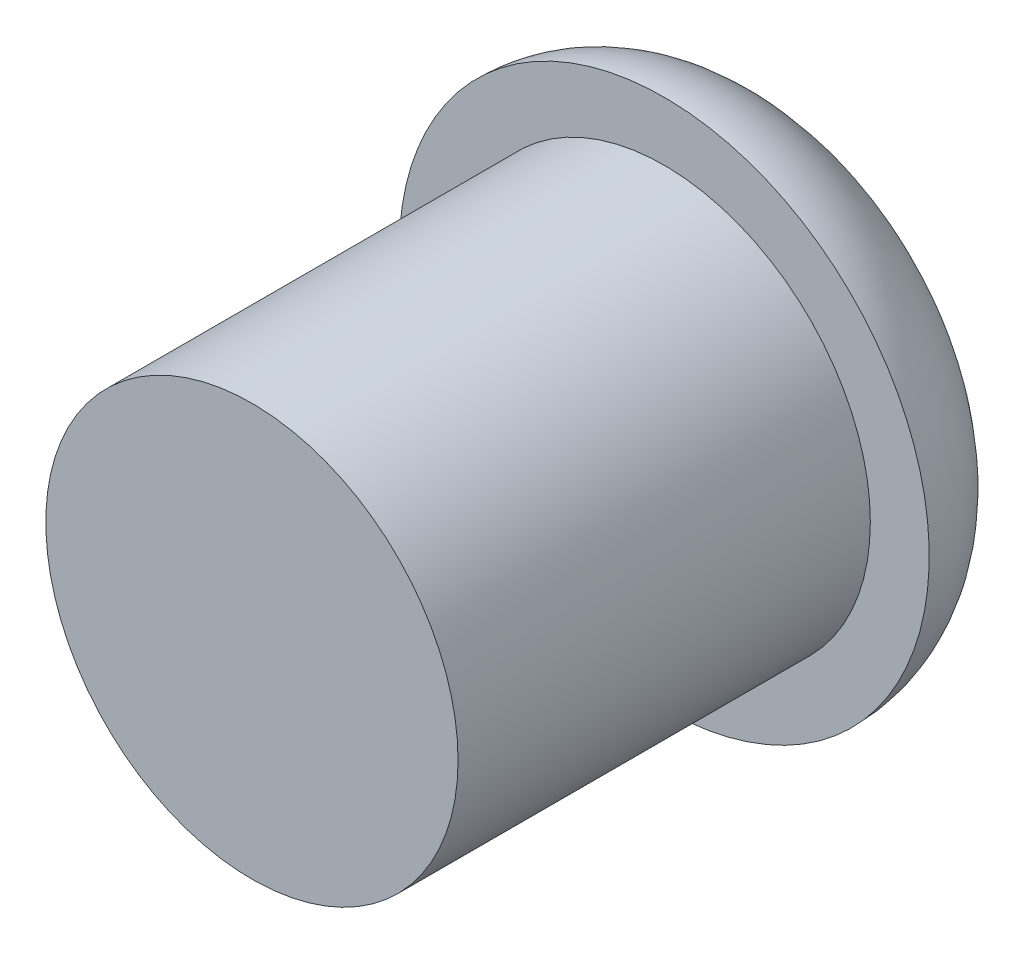
from build123d import *

# Parameters (mm, degrees)
CROQUIS1_R              = 3.5
SALIENTE_EXTRUIR1_DEPTH = 7
CROQUIS2_R              = 4.5
SALIENTE_EXTRUIR2_DEPTH = 2
REDONDEO1_R             = 2


with BuildPart() as part:
    # Croquis1 → Saliente-Extruir1 (new body)
    with BuildSketch(Plane.XY):
        Circle(CROQUIS1_R)
    extrude(amount=SALIENTE_EXTRUIR1_DEPTH)

    # Croquis2 → Saliente-Extruir2 (add)
    with BuildSketch(Plane(origin=(0, 0, 0), x_dir=(-1, 0, 0), z_dir=(0, 0, -1))):
        Circle(CROQUIS2_R)
    extrude(amount=SALIENTE_EXTRUIR2_DEPTH)

    # Redondeo1
    redondeo1_edges = [part.edges().sort_by_distance(p)[0] for p in [
        (4.5, 0, -2),
    ]]
    fillet(redondeo1_edges, radius=REDONDEO1_R - 0.0001)  # a hair under: the kernel refuses the full size


solid = part.part
